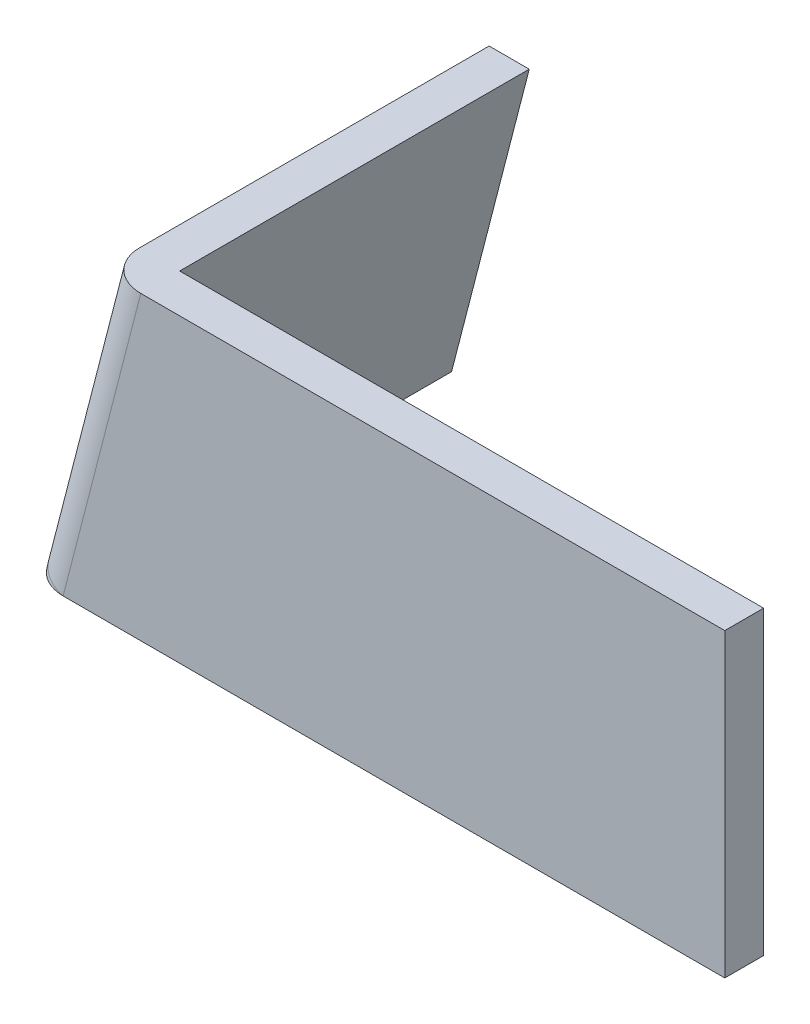
from build123d import *

# Parameters (mm, degrees)
BASE_FLANGE5_DEPTH       = 3.175
EDGE_FLANGE4_START       = -37.332955736
EDGE_FLANGE4_DEPTH       = 25.4
CUT_EXTRUDE4_DEPTH       = 4.699
CUT_EXTRUDE4_DEPTH_BACK  = 36.068
BOSS_EXTRUDE1_DEPTH      = 3.81
BOSS_EXTRUDE1_DEPTH_BACK = 31.75
CUT_EXTRUDE8_DEPTH       = 2.794
CUT_EXTRUDE8_DEPTH_BACK  = 3.81


# Read off the part's stored shape, not the designer's step: Edge-Flange4
# Sheet-metal steps are written as plain solids
with BuildPart() as part:
    # Sketch13 → Base-Flange5 (new body)
    with BuildSketch(Plane.XY):
        Polygon((-47.732145582, 0), (0, 0), (0, -24.593455331), (-54.08210266, -24.593455331), align=None)
    extrude(amount=-BASE_FLANGE5_DEPTH)

    # Edge-Flange4 outline → Edge-Flange4 (add)
    with BuildSketch(Plane(origin=(0, 0, 0), x_dir=(0.9682462728649326, -0.24999831016062188, 0), z_dir=(0.24999831016062188, 0.9682462728649326, 0)).offset(EDGE_FLANGE4_START)):
        with BuildLine():
            ThreePointArc((-49.391472056, 3.175), (-48.461536086, 0.92993597), (-46.216472056, 0))
            Line((-46.216472056, 0), (-46.216472056, 31.75))
            Line((-46.216472056, 31.75), (-49.391472056, 31.75))
            Line((-49.391472056, 31.75), (-49.391472056, 3.175))
        make_face()
    extrude(amount=EDGE_FLANGE4_DEPTH)

    # Sketch51 → Cut-Extrude4 (cut, two sides: drawn at the far end of the back side and taken through both)
    with BuildSketch(Plane.XY.offset(-CUT_EXTRUDE4_DEPTH_BACK)):
        Polygon((-47.732145582, 0), (-51.011270004, 0), (-50.806327498, 0.793744635), align=None)
    extrude(amount=CUT_EXTRUDE4_DEPTH + CUT_EXTRUDE4_DEPTH_BACK, mode=Mode.SUBTRACT)

    # Sketch50 → Boss-Extrude1 (add, two sides: drawn at the far end of the back side and taken through both)
    with BuildSketch(Plane.XY.offset(-BOSS_EXTRUDE1_DEPTH_BACK)):
        Polygon((-54.08210266, -24.593455331), (-57.156284576, -23.799710696), (-57.361227082, -24.593455331), align=None)
    extrude(amount=BOSS_EXTRUDE1_DEPTH + BOSS_EXTRUDE1_DEPTH_BACK)

    # Sketch65 → Cut-Extrude8 (cut, two sides: drawn at the far end of the back side and taken through both)
    with BuildSketch(Plane(origin=(-9.11279098, -35.948881484, -0.60974114), x_dir=(0.9654972069490037, -0.2461867540495814, 0.08489537975769736), z_dir=(0.2456878772322161, 0.9692095868518577, 0.01643909168960169)).offset(-CUT_EXTRUDE8_DEPTH_BACK)):
        with BuildLine():
            Line((-45.838084729, -8.341935896), (-46.161536125, -4.546207203))
            ThreePointArc((-46.161536125, -4.546207203), (-48.47736426, -3.810311856), (-49.594602425, -1.652446987))
            Line((-49.594602425, -1.652446987), (-50.428184851, -1.652446987))
            Line((-50.428184851, -1.652446987), (-50.011393638, -8.730016823))
            Line((-50.011393638, -8.730016823), (-50.30622786, -10.563261001))
            Line((-50.30622786, -10.563261001), (-45.635329216, -9.987874877))
            Line((-45.635329216, -9.987874877), (-45.838084729, -8.341935896))
        make_face()
    extrude(amount=CUT_EXTRUDE8_DEPTH + CUT_EXTRUDE8_DEPTH_BACK, mode=Mode.SUBTRACT)


solid = part.part
